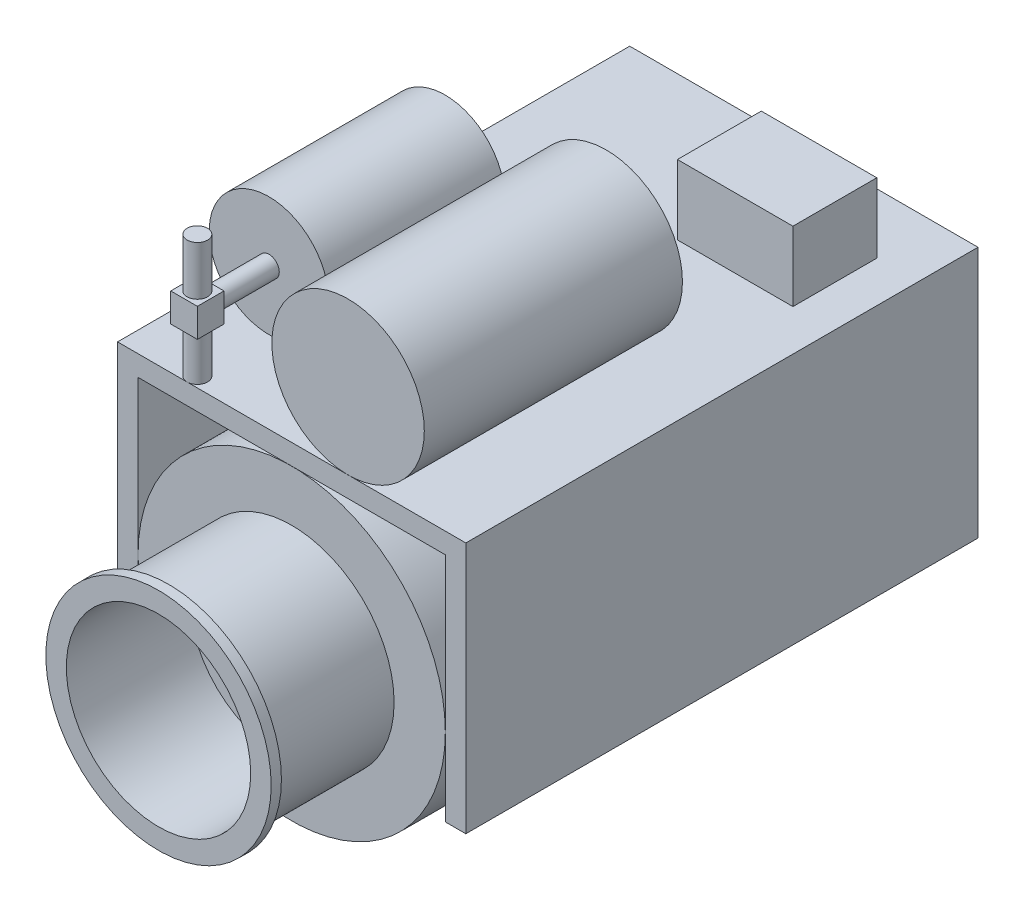
from build123d import *

# Parameters (mm, degrees)
SKETCH1_R                 = 50
BOSS_EXTRUDE1_DEPTH       = 65
SHELL1_T                  = -5
SKETCH3_R                 = 55
BOSS_EXTRUDE2_DEPTH       = 5
SHELL2_START              = -5
SHELL2_OUTLINE_R          = 45
SHELL2_DEPTH              = 5
SKETCH5_R                 = 75
BOSS_EXTRUDE3_DEPTH       = 250
BOSS_EXTRUDE4_DEPTH       = 250
SKETCH9_R                 = 37.210694341
BOSS_EXTRUDE5_DEPTH       = 126
SKETCH10_W                = 56.36992765
SKETCH10_H                = 40.935304603
BOSS_EXTRUDE6_DEPTH       = 34
SKETCH12_R                = 29.163363005
BOSS_EXTRUDE7_DEPTH       = 86
SKETCH16_R                = 5
BOSS_EXTRUDE10_DEPTH      = 60
BOSS_EXTRUDE11_DEPTH      = 7
BOSS_EXTRUDE11_DEPTH_BACK = 7
SKETCH19_R                = 5
BOSS_EXTRUDE12_DEPTH      = 28.48


# Read off the part's stored shape, not the designer's step: Shell2
with BuildPart() as part:
    # Sketch1 → Boss-Extrude1 (new body)
    with BuildSketch(Plane.XY):
        Circle(SKETCH1_R)
    extrude(amount=-BOSS_EXTRUDE1_DEPTH)

    # Shell1
    shell1_openings = [part.faces().sort_by_distance(p)[0] for p in [
        (0, 0, 0),
    ]]
    offset(amount=SHELL1_T, openings=shell1_openings, kind=Kind.INTERSECTION)

    # Sketch3 → Boss-Extrude2 (add)
    with BuildSketch(Plane.XY):
        Circle(SKETCH3_R)
    extrude(amount=-BOSS_EXTRUDE2_DEPTH)

    # Shell2 outline → Shell2 (cut)
    with BuildSketch(Plane.XY.offset(SHELL2_START)):
        Circle(SHELL2_OUTLINE_R)
    extrude(amount=SHELL2_DEPTH, mode=Mode.SUBTRACT)

    # Sketch5 → Boss-Extrude3 (add)
    with BuildSketch(Plane(origin=(0, 0, -65), x_dir=(-1, 0, 0), z_dir=(0, 0, -1))):
        Circle(SKETCH5_R)
    extrude(amount=BOSS_EXTRUDE3_DEPTH)


with BuildPart() as body_2:
    # Sketch6 → Boss-Extrude4 (new body)
    with BuildSketch(Plane.XY.offset(-65)):
        Polygon((75, -37.942743418), (85, -37.942743418), (85, 85), (-85, 85), (-85, -37.942743418), (-75, -37.942743418), (-75, 75), (75, 75), align=None)
    extrude(amount=-BOSS_EXTRUDE4_DEPTH)

    # Sketch10 → Boss-Extrude6 (add)
    with BuildSketch(Plane(origin=(0, 85, 0), x_dir=(1, 0, 0), z_dir=(0, 1, 0))):
        with Locations((36.741113558, 265.206826046)):
            Rectangle(SKETCH10_W, SKETCH10_H)
    extrude(amount=BOSS_EXTRUDE6_DEPTH)

    # Sketch16 → Boss-Extrude10 (add)
    with BuildSketch(Plane(origin=(0, 85, 0), x_dir=(1, 0, 0), z_dir=(0, 1, 0))):
        with Locations(Location((-51.052896517, 70.02, 0), (0, 0, 90))):
            Circle(SKETCH16_R)
    extrude(amount=BOSS_EXTRUDE10_DEPTH)

    # Sketch18 → Boss-Extrude11 (add, two sides: drawn at the far end of the back side and taken through both)
    with BuildSketch(Plane(origin=(0, 114, 0), x_dir=(1, 0, 0), z_dir=(0, 1, 0)).offset(-BOSS_EXTRUDE11_DEPTH_BACK)):
        Polygon((-57.552896517, 70.02), (-57.552896517, 76.52), (-44.552896517, 76.52), (-44.552896517, 63.52), (-57.552896517, 63.52), align=None)
    extrude(amount=BOSS_EXTRUDE11_DEPTH + BOSS_EXTRUDE11_DEPTH_BACK)



with BuildPart() as body_3:
    # Sketch9 → Boss-Extrude5 (new body)
    with BuildSketch(Plane.XY.offset(-65)):
        with Locations((27.529934173, 122.210694341)):
            Circle(SKETCH9_R)
    extrude(amount=-BOSS_EXTRUDE5_DEPTH)


with BuildPart() as body_4:
    # Sketch12 → Boss-Extrude7 (new body)
    with BuildSketch(Plane.XY.offset(-105)):
        with Locations((-51.113194065, 114.167789901)):
            Circle(SKETCH12_R)
    extrude(amount=-BOSS_EXTRUDE7_DEPTH)


with BuildPart() as body_2_1:
    add(body_2.part)

    add(body_4.part)  # Boss-Extrude12 merges body 4
    # Sketch19 → Boss-Extrude12 (add)
    with BuildSketch(Plane(origin=(0, 0, -76.52), x_dir=(-1, 0, 0), z_dir=(0, 0, -1))):
        with Locations(Location((51.052896517, 114, 0), (0, 0, 180))):
            Circle(SKETCH19_R)
    extrude(amount=BOSS_EXTRUDE12_DEPTH)


solid = Compound([part.part, body_3.part, body_2_1.part])
